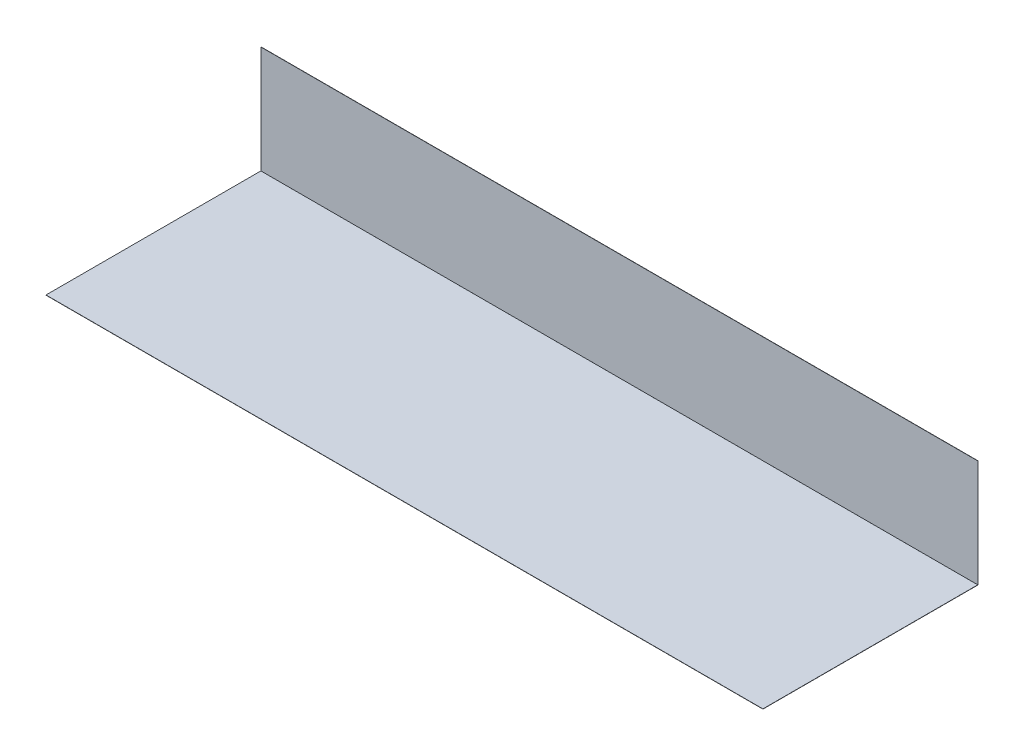
from build123d import *

# Parameters (mm, degrees)
SKETCH_1_W                       = 10000
SKETCH_1_H                       = 3
SM_BASE_FLANGE_1_DEPTH           = 1500
SM_EDGE_FLANGE_1_STRIP_W         = 12.2
SM_EDGE_FLANGE_1_STRIP_H         = 3
SM_EDGE_FLANGE_1_STRIP_CUT_DEPTH = 10000
SM_EDGE_FLANGE_1_DEPTH           = 10000
SKETCH_9_R                       = 124.585629419
EXTRUDE_1_DEPTH                  = 100


# Sheet-metal steps are written as plain solids
with BuildPart() as part:
    # Sketch 1 → 基体-法兰1 (new, symmetric)
    with BuildSketch(Plane.XY):
        with Locations((-5000, 1.5)):
            Rectangle(SKETCH_1_W, SKETCH_1_H)
    extrude(amount=SM_BASE_FLANGE_1_DEPTH, both=True)

    # 边线-法兰1 strip (across the edge) → 边线-法兰1 strip cut (cut)
    with BuildSketch(Plane(origin=(0, 3, -1500), x_dir=(0, 0, 1), z_dir=(-1, 0, 0))):
        with Locations((-3, -1.5)):
            Rectangle(SM_EDGE_FLANGE_1_STRIP_W, SM_EDGE_FLANGE_1_STRIP_H)
    extrude(amount=SM_EDGE_FLANGE_1_STRIP_CUT_DEPTH, mode=Mode.SUBTRACT)

    # 边线-法兰1 section (across the edge) → 边线-法兰1 (add)
    with BuildSketch(Plane(origin=(0, 3, -1500), x_dir=(0, 0, 1), z_dir=(-1, 0, 0))):
        with BuildLine():
            Line((0, 0.1), (0, 1497))
            Line((0, 1497), (3, 1497))
            Line((3, 1497), (3, 0.1))
            ThreePointArc((3, 0.1), (3.029289322, 0.029289322), (3.1, 0))
            Line((3.1, 0), (3.1, -3))
            ThreePointArc((3.1, -3), (0.907968978, -2.092031022), (0, 0.1))
        make_face()
    extrude(amount=SM_EDGE_FLANGE_1_DEPTH)

    # 草图9 → 凸台-拉伸1 (add)
    with BuildSketch(Plane.XZ):
        with Locations(Location((-5580.104880993, -302.876251182, 0), (0, 0, 180))):
            Circle(SKETCH_9_R)
    extrude(amount=EXTRUDE_1_DEPTH)


solid = part.part
